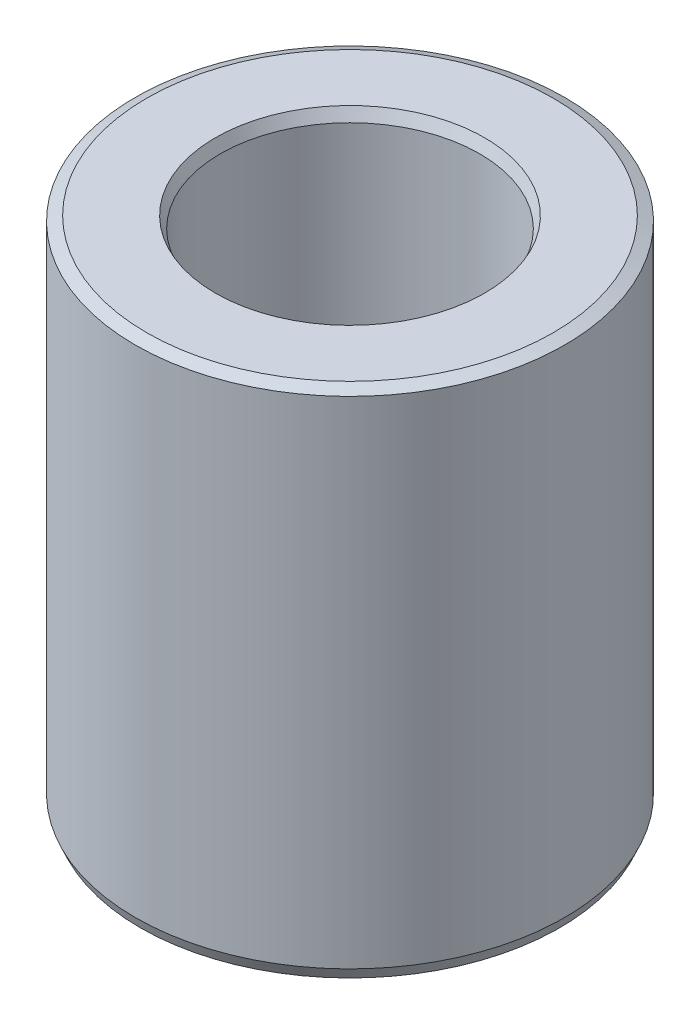
from build123d import *
from OCP.BRepFilletAPI import BRepFilletAPI_MakeChamfer

# Parameters (mm, degrees)
SKETCH1_R           = 15
BOSS_EXTRUDE1_DEPTH = 35.798714228
SKETCH2_R           = 9.062373659
CUT_EXTRUDE1_DEPTH  = 42.611872589
CHAMFER1_SIZE       = 0.348604316
CHAMFER1_SIZE2      = 0.796052163


with BuildPart() as part:
    # Sketch1 → Boss-Extrude1 (new body)
    with BuildSketch(Plane(origin=(0, 0, 0), x_dir=(1, 0, 0), z_dir=(0, 1, 0))):
        Circle(SKETCH1_R)
    extrude(amount=BOSS_EXTRUDE1_DEPTH)

    # Sketch2 → Cut-Extrude1 (cut, through all)
    with BuildSketch(Plane(origin=(0, 0, 0), x_dir=(1, 0, 0), z_dir=(0, 1, 0))):
        Circle(SKETCH2_R)
    extrude(amount=CUT_EXTRUDE1_DEPTH, mode=Mode.SUBTRACT)

    # Chamfer1: one chamfer whose edges measure the first distance from different faces: ONE call of the kernel's chamfer builder (chamfer() names one face for all edges)
    chamfer1_edges_1 = [part.edges().sort_by_distance(p)[0] for p in [
        (-9.062373659, 35.798714228, 0),
    ]]
    chamfer1_side_1 = [part.faces().sort_by_distance(p)[0] for p in [
        (-14.575735931, 35.798714228, 0),
    ]]
    chamfer1_edges_2 = [part.edges().sort_by_distance(p)[0] for p in [
        (-9.062373659, 0, 0),
    ]]
    chamfer1_side_2 = [part.faces().sort_by_distance(p)[0] for p in [
        (-9.062373659, 17.899357114, 0),
    ]]
    chamfer1_edges_3 = [part.edges().sort_by_distance(p)[0] for p in [
        (-15, 0, 0),
    ]]
    chamfer1_side_3 = [part.faces().sort_by_distance(p)[0] for p in [
        (-14.575735931, 0, 0),
    ]]
    chamfer1_edges_4 = [part.edges().sort_by_distance(p)[0] for p in [
        (-15, 35.798714228, 0),
    ]]
    chamfer1_side_4 = [part.faces().sort_by_distance(p)[0] for p in [
        (-15, 17.899357114, 0),
    ]]
    chamfer1 = BRepFilletAPI_MakeChamfer(part.part.solid().wrapped)
    for e in chamfer1_edges_1:
        chamfer1.Add(CHAMFER1_SIZE, CHAMFER1_SIZE2, e.wrapped, chamfer1_side_1[0].wrapped)  # the first distance lies on this face
    for e in chamfer1_edges_2:
        chamfer1.Add(CHAMFER1_SIZE, CHAMFER1_SIZE2, e.wrapped, chamfer1_side_2[0].wrapped)  # the first distance lies on this face
    for e in chamfer1_edges_3:
        chamfer1.Add(CHAMFER1_SIZE, CHAMFER1_SIZE2, e.wrapped, chamfer1_side_3[0].wrapped)  # the first distance lies on this face
    for e in chamfer1_edges_4:
        chamfer1.Add(CHAMFER1_SIZE, CHAMFER1_SIZE2, e.wrapped, chamfer1_side_4[0].wrapped)  # the first distance lies on this face
    add(Compound.cast(chamfer1.Shape()), mode=Mode.REPLACE)


solid = part.part
